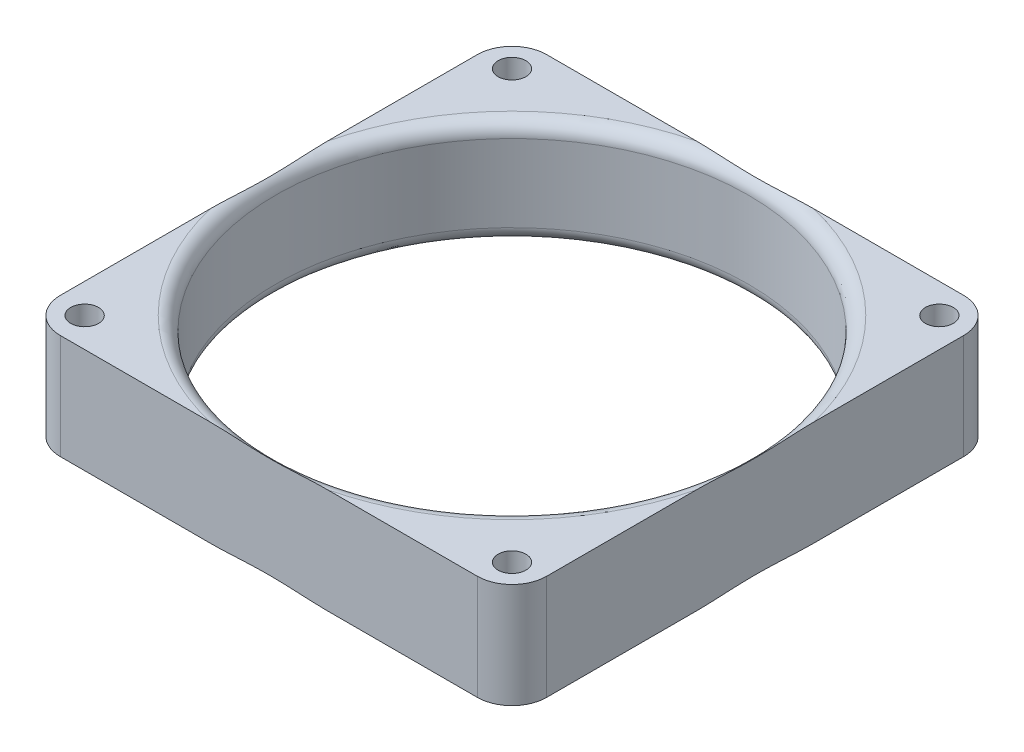
from build123d import *

# Parameters (mm, degrees)
SKETCH_1_W      = 70
SKETCH_1_H      = 70
SKETCH_1_R      = 2
SKETCH_1_R_2    = 34
EXTRUDE_1_DEPTH = 15.1
FILLET_1_R      = 5
FILLET_2_R      = 2


with BuildPart() as part:
    # Эскиз1 → Бобышка-Вытянуть1 (new body)
    with BuildSketch(Plane(origin=(0, 0, 0), x_dir=(1, 0, 0), z_dir=(0, 1, 0))):
        Rectangle(SKETCH_1_W, SKETCH_1_H)
        with Locations(Location((30.75, 30.75, 0), (0, 0, 270))):
            Circle(SKETCH_1_R, mode=Mode.SUBTRACT)
        with Locations(Location((0, 0, 0), (0, 0, 270))):
            Circle(SKETCH_1_R_2, mode=Mode.SUBTRACT)
        with Locations(Location((30.75, -30.75, 0), (0, 0, 270))):
            Circle(SKETCH_1_R, mode=Mode.SUBTRACT)
        with Locations(Location((-30.75, -30.75, 0), (0, 0, 270))):
            Circle(SKETCH_1_R, mode=Mode.SUBTRACT)
        with Locations(Location((-30.75, 30.75, 0), (0, 0, 270))):
            Circle(SKETCH_1_R, mode=Mode.SUBTRACT)
    extrude(amount=EXTRUDE_1_DEPTH)

    # Скругление1
    fillet_1_edges = [part.edges().sort_by_distance(p)[0] for p in [
        (35, 7.55, 35),
        (-35, 7.55, 35),
        (-35, 7.55, -35),
        (35, 7.55, -35),
    ]]
    fillet(fillet_1_edges, radius=FILLET_1_R)

    # Скругление2
    # the kernel refuses this fillet: 2 mm, written as the material it takes off along each edge
    with BuildSketch(Plane(origin=(0, 0, 0), x_dir=(0, 0, 1), z_dir=(-1, 0, 0))) as fillet_2_piece_1:
        with BuildLine():
            CenterArc((34 + FILLET_2_R, FILLET_2_R), FILLET_2_R, 180, 90)
            Line((34, FILLET_2_R), (34, 0))
            Line((34, 0), (34 + FILLET_2_R, 0))
        make_face()
    revolve(axis=Axis((0, 0, 0), (0, 1, 0)), mode=Mode.SUBTRACT)
    with BuildSketch(Plane(origin=(0, 15.1, 0), x_dir=(0, 0, 1), z_dir=(-1, 0, 0))) as fillet_2_piece_2:
        with BuildLine():
            CenterArc((34 + FILLET_2_R, -FILLET_2_R), FILLET_2_R, 90, 90)
            Line((34, -FILLET_2_R), (34, 0))
            Line((34, 0), (34 + FILLET_2_R, 0))
        make_face()
    revolve(axis=Axis((0, 15.1, 0), (0, 1, 0)), mode=Mode.SUBTRACT)


solid = part.part
